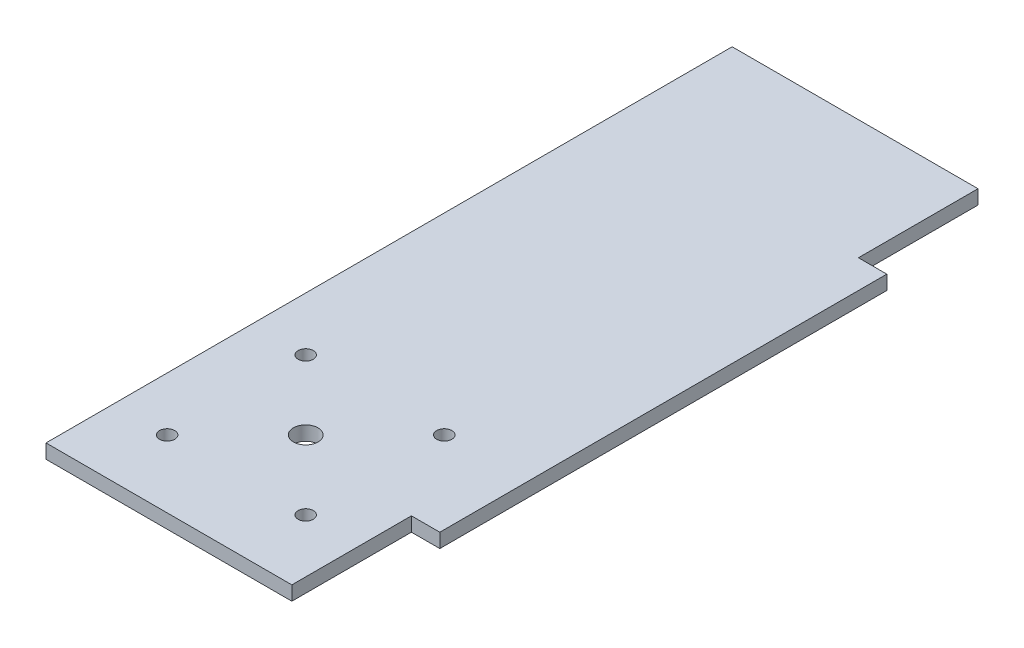
from build123d import *

# Parameters (mm, degrees)
BOSS_EXTRUDE1_DEPTH  = 3.175
SKETCH3_R            = 2.75
CUT_EXTRUDE1_DEPTH   = 132.230581897
M3_CLEARANCE_HOLE1_D = 3.4


with BuildPart() as part:
    # Sketch1 → Boss-Extrude1 (new body)
    with BuildSketch(Plane(origin=(0, 0, 0), x_dir=(1, 0, 0), z_dir=(0, 1, 0))):
        Polygon((27.5, 26.75), (-27.5, 26.75), (-27.5, 0), (-27.5, -100), (-27.5, -126.75), (27.5, -126.75), (27.5, -100), (33.85, -100), (33.85, 0), (27.5, 0), align=None)
    extrude(amount=BOSS_EXTRUDE1_DEPTH)

    # Sketch3 → Cut-Extrude1 (cut, through all)
    with BuildSketch(Plane(origin=(0, 3.175, 0), x_dir=(1, 0, 0), z_dir=(0, 1, 0))):
        with Locations((0, -96.15)):
            Circle(SKETCH3_R)
    extrude(amount=-CUT_EXTRUDE1_DEPTH, mode=Mode.SUBTRACT)

    # M3 Clearance Hole1 (through all)
    with Locations(Plane(origin=(0, 3.175, 0), x_dir=(1, 0, 0), z_dir=(0, 1, 0))):
        with Locations((15.5, -111.65), (-15.5, -111.65), (-15.5, -80.65), (15.5, -80.65)):
            Hole(M3_CLEARANCE_HOLE1_D / 2)


solid = part.part
